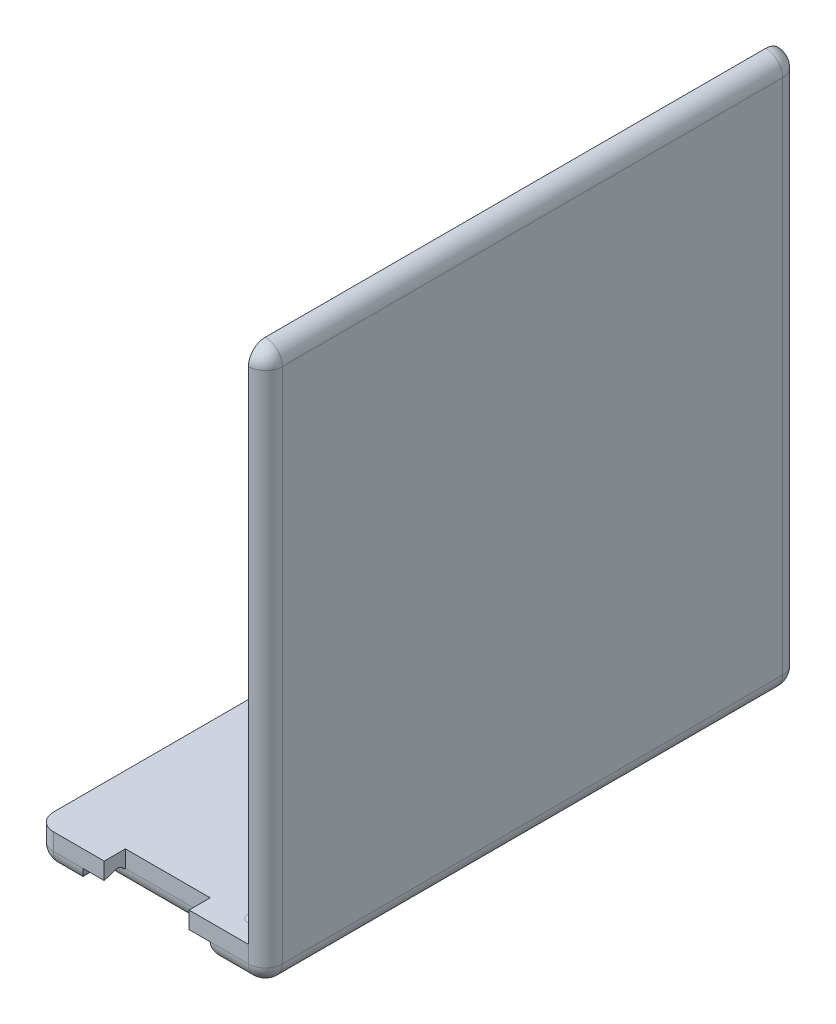
from build123d import *

# Parameters (mm, degrees)
SKETCH1_W               = 25
SKETCH1_H               = 63
BOSS_EXTRUDE1_DEPTH     = 4
SKETCH3_W               = 63
SKETCH3_H               = 4
BOSS_EXTRUDE2_DEPTH     = 2
SKETCH4_W               = 2
SKETCH4_H               = 63
BOSS_EXTRUDE3_DEPTH     = 61
SKETCH6_W               = 10
SKETCH6_H               = 2.5
CUT_EXTRUDE1_DEPTH      = 94.909530933
SKETCH6_3_W             = 10
SKETCH6_3_H             = 2.5
CUT_EXTRUDE2_DEPTH      = 80
SKETCH8_W               = 15
SKETCH8_H               = 2
CUT_EXTRUDE3_DEPTH      = 2.5
CUT_EXTRUDE5_DEPTH      = 15
SKETCH11_W              = 15
SKETCH11_H              = 2
CUT_EXTRUDE6_DEPTH      = 3
CUT_EXTRUDE7_DEPTH      = 15
FILLET6_R               = 2
FILLET7_R               = 2
BOSS_EXTRUDE4_DEPTH     = 53
FILLET8_R               = 0.4
FILLET9_R               = 2
CUT_EXTRUDE8_DEPTH      = 94.909530933
CUT_EXTRUDE8_DEPTH_BACK = 2
SKETCH15_W              = 11
SKETCH15_H              = 8


# Some blends are built 0.0001 mm under size
with BuildPart() as part:
    # Sketch1 → Boss-Extrude1 (new body)
    with BuildSketch(Plane(origin=(0, 0, 0), x_dir=(1, 0, 0), z_dir=(0, 1, 0))):
        with Locations((-12.5, -31.5)):
            Rectangle(SKETCH1_W, SKETCH1_H)
    extrude(amount=BOSS_EXTRUDE1_DEPTH)

    # Sketch3 → Boss-Extrude2 (add)
    with BuildSketch(Plane(origin=(0, 0, 0), x_dir=(0, 0, -1), z_dir=(1, 0, 0))):
        with Locations((-31.5, 2)):
            Rectangle(SKETCH3_W, SKETCH3_H)
    extrude(amount=BOSS_EXTRUDE2_DEPTH)

    # Sketch4 → Boss-Extrude3 (add)
    with BuildSketch(Plane(origin=(0, 4, 0), x_dir=(1, 0, 0), z_dir=(0, 1, 0))):
        with Locations((1, -31.5)):
            Rectangle(SKETCH4_W, SKETCH4_H)
    extrude(amount=BOSS_EXTRUDE3_DEPTH)

    # Sketch6 → Cut-Extrude1 (cut, through all)
    with BuildSketch(Plane.XZ):
        with Locations((-12, 1.25)):
            Rectangle(SKETCH6_W, SKETCH6_H)
    extrude(amount=-CUT_EXTRUDE1_DEPTH, mode=Mode.SUBTRACT)

    # Sketch6<3> → Cut-Extrude2 (cut)
    with BuildSketch(Plane.XZ):
        with Locations((-12, 61.75)):
            Rectangle(SKETCH6_3_W, SKETCH6_3_H)
    extrude(amount=-CUT_EXTRUDE2_DEPTH, mode=Mode.SUBTRACT)

    # Sketch8 → Cut-Extrude3 (cut)
    with BuildSketch(Plane.XY.offset(63)):
        with Locations((-12, 1)):
            Rectangle(SKETCH8_W, SKETCH8_H)
    extrude(amount=-CUT_EXTRUDE3_DEPTH, mode=Mode.SUBTRACT)

    # Sketch9 → Cut-Extrude5 (cut)
    with BuildSketch(Plane.ZY.offset(4.5)):
        with BuildLine():
            ThreePointArc((61.5, 2.5), (61, 2.366025404), (60.633974596, 2))
            Line((60.633974596, 2), (63, 2))
            Line((63, 2), (61.5, 2.5))
        make_face()
    extrude(amount=CUT_EXTRUDE5_DEPTH, mode=Mode.SUBTRACT)

    # Sketch11 → Cut-Extrude6 (cut)
    with BuildSketch(Plane(origin=(0, 0, 0), x_dir=(-1, 0, 0), z_dir=(0, 0, -1))):
        with Locations((12, 1)):
            Rectangle(SKETCH11_W, SKETCH11_H)
    extrude(amount=-CUT_EXTRUDE6_DEPTH, mode=Mode.SUBTRACT)

    # Sketch12 → Cut-Extrude7 (cut)
    with BuildSketch(Plane.ZY.offset(4.5)):
        with BuildLine():
            ThreePointArc((2.766025404, 2), (2.4, 2.366025404), (1.9, 2.5))
            Line((1.9, 2.5), (0, 2))
            Line((0, 2), (2.766025404, 2))
        make_face()
    extrude(amount=CUT_EXTRUDE7_DEPTH, mode=Mode.SUBTRACT)

    # Fillet6
    fillet6_edges = [part.edges().sort_by_distance(p)[0] for p in [
        (-19.5, 0, 1.5),
        (-22.25, 0, 0),
        (-25, 0, 31.5),
        (-22.25, 0, 63),
        (-19.5, 0, 61.75),
        (-12, 0, 60.5),
        (-4.5, 0, 61.75),
        (-1.25, 0, 63),
        (2, 0, 31.5),
        (-1.25, 0, 0),
        (-4.5, 0, 1.5),
        (-12, 0, 3),
    ]]
    fillet(fillet6_edges, radius=FILLET6_R - 0.0001)  # a hair under: the kernel refuses the full size

    # Fillet7
    # the kernel refuses this fillet: 2 mm, written as the material it takes off along each edge
    with BuildSketch(Plane(origin=(-23, 0, 61), x_dir=(0, 0, 1), z_dir=(1, 0, 0))) as fillet7_piece_1:
        with BuildLine():
            CenterArc((0.0001, -1.9999), 1.9999, 0, 90)
            Line((2, -1.9999), (2, 0))
            Line((2, 0), (0.0001, 0))
        make_face()
    revolve(axis=Axis((-23, 0, 61), (0, -1, 0)), revolution_arc=90, mode=Mode.SUBTRACT)
    with BuildSketch(Plane(origin=(-23, 0, 2), x_dir=(-1, 0, 0), z_dir=(0, 0, 1))) as fillet7_piece_2:
        with BuildLine():
            CenterArc((0.0001, -1.9999), 1.9999, 0, 90)
            Line((2, -1.9999), (2, 0))
            Line((2, 0), (0.0001, 0))
        make_face()
    revolve(axis=Axis((-23, 0, 2), (0, -1, 0)), revolution_arc=90, mode=Mode.SUBTRACT)
    with BuildSketch(Plane(origin=(-25, 0, 63), x_dir=(0, 0, -1), z_dir=(0, 1, 0)), Plane(origin=(-25, 0, 0), x_dir=(1, 0, 0), z_dir=(0, 1, 0))) as fillet7_piece_3:
        with BuildLine():
            CenterArc((FILLET7_R, -FILLET7_R), FILLET7_R, 90, 90)
            Line((0, -FILLET7_R), (0, 0))
            Line((0, 0), (FILLET7_R, 0))
        make_face()
    extrude(amount=9, mode=Mode.SUBTRACT)

    # Sketch13 → Boss-Extrude4 (add)
    with BuildSketch(Plane(origin=(0, 4, 0), x_dir=(1, 0, 0), z_dir=(0, 1, 0))):
        Polygon((0, -4.25), (-1.5, -4.25), (-1.5, -2.6), (-2.7, -2.6), (-2.7, -5.6), (0, -5.6), align=None)
        Polygon((-1.5, -60.4), (-2.7, -60.4), (-2.7, -57.4), (0, -57.4), (0, -58.75), (-1.5, -58.75), align=None)
    extrude(amount=BOSS_EXTRUDE4_DEPTH)

    # Fillet8
    fillet8_edges = [part.edges().sort_by_distance(p)[0] for p in [
        (0, 30.5, 5.6),
        (-1.5, 4, 3.425),
        (-2.1, 4, 2.6),
        (-1.5, 30.5, 2.6),
        (-2.7, 4, 4.1),
        (-2.7, 30.5, 2.6),
        (-1.35, 4, 5.6),
        (-2.7, 30.5, 5.6),
        (0, 57, 4.925),
        (-2.1, 57, 2.6),
        (-2.7, 57, 4.1),
        (-1.35, 57, 5.6),
        (-1.5, 4, 59.575),
        (-1.5, 30.5, 60.4),
        (-1.35, 4, 57.4),
        (0, 30.5, 57.4),
        (-2.7, 4, 58.9),
        (-2.7, 30.5, 57.4),
        (-2.1, 4, 60.4),
        (-2.7, 30.5, 60.4),
        (0, 57, 58.075),
        (-1.35, 57, 57.4),
        (-2.7, 57, 58.9),
        (-2.1, 57, 60.4),
    ]]
    fillet(fillet8_edges, radius=FILLET8_R)

    # Fillet9
    # the kernel refuses this fillet: 2 mm, written as the material it takes off along each edge
    with BuildSketch(Plane(origin=(0, 0, 61), x_dir=(1, 0, 0), z_dir=(0, 0, -1))) as fillet9_piece_1:
        with BuildLine():
            CenterArc((0.0001, -1.9999), 1.9999, 0, 90)
            Line((2, -1.9999), (2, 0))
            Line((2, 0), (0.0001, 0))
        make_face()
    revolve(axis=Axis((0, 0, 61), (0, -1, 0)), revolution_arc=90, mode=Mode.SUBTRACT)
    with BuildSketch(Plane(origin=(0, 0, 2), x_dir=(0, 0, -1), z_dir=(-1, 0, 0))) as fillet9_piece_2:
        with BuildLine():
            CenterArc((0.0001, -1.9999), 1.9999, 0, 90)
            Line((2, -1.9999), (2, 0))
            Line((2, 0), (0.0001, 0))
        make_face()
    revolve(axis=Axis((0, 0, 2), (0, -1, 0)), revolution_arc=90, mode=Mode.SUBTRACT)
    with BuildSketch(Plane(origin=(0, 63, 61), x_dir=(0, 0, 1), z_dir=(1, 0, 0))) as fillet9_piece_3_section:
        Polygon((0, 0), (FILLET9_R, 0), (FILLET9_R, -FILLET9_R), (0, -FILLET9_R), align=None)
    fillet9_piece_3 = extrude(amount=FILLET9_R, mode=Mode.PRIVATE)
    fillet9_piece_3 = fillet9_piece_3 - Plane(origin=(0, 63, 61), x_dir=(0, -0.7071067811865475, -0.7071067811865475), z_dir=(1, 0, 0)) * Sphere(FILLET9_R, mode=Mode.PRIVATE)
    add(fillet9_piece_3, mode=Mode.SUBTRACT)
    with BuildSketch(Plane(origin=(0, 63, 2), x_dir=(0, 0, -1), z_dir=(0, 1, 0))) as fillet9_piece_4_section:
        Polygon((0, 0), (FILLET9_R, 0), (FILLET9_R, -FILLET9_R), (0, -FILLET9_R), align=None)
    fillet9_piece_4 = extrude(amount=FILLET9_R, mode=Mode.PRIVATE)
    fillet9_piece_4 = fillet9_piece_4 - Plane(origin=(0, 63, 2), x_dir=(-0.7071067811865474, 0, 0.7071067811865476), z_dir=(0, 1, 0)) * Sphere(FILLET9_R, mode=Mode.PRIVATE)
    add(fillet9_piece_4, mode=Mode.SUBTRACT)
    with BuildSketch(Plane(origin=(2, 63, 63), x_dir=(-1, 0, 0), z_dir=(0, -1, 0)), Plane(origin=(2, 63, 0), x_dir=(0, 0, 1), z_dir=(0, -1, 0))) as fillet9_piece_5:
        with BuildLine():
            CenterArc((FILLET9_R, FILLET9_R), FILLET9_R, 180, 90)
            Line((0, FILLET9_R), (0, 0))
            Line((0, 0), (FILLET9_R, 0))
        make_face()
    extrude(amount=63, mode=Mode.SUBTRACT)
    with BuildSketch(Plane(origin=(2, 65, 2), x_dir=(-1, 0, 0), z_dir=(0, 0, 1))) as fillet9_piece_6:
        with BuildLine():
            CenterArc((FILLET9_R, FILLET9_R), FILLET9_R, 180, 90)
            Line((0, FILLET9_R), (0, 0))
            Line((0, 0), (FILLET9_R, 0))
        make_face()
    extrude(amount=59, mode=Mode.SUBTRACT)
    with BuildSketch(Plane(origin=(-5, 65, 0), x_dir=(0, 0, 1), z_dir=(1, 0, 0))) as fillet9_piece_7:
        with BuildLine():
            CenterArc((FILLET9_R, FILLET9_R), FILLET9_R, 180, 90)
            Line((0, FILLET9_R), (0, 0))
            Line((0, 0), (FILLET9_R, 0))
        make_face()
    extrude(amount=5, mode=Mode.SUBTRACT)
    with BuildSketch(Plane(origin=(0, 65, 63), x_dir=(0, -1, 0), z_dir=(-1, 0, 0))) as fillet9_piece_8:
        with BuildLine():
            CenterArc((FILLET9_R, -FILLET9_R), FILLET9_R, 90, 90)
            Line((0, -FILLET9_R), (0, 0))
            Line((0, 0), (FILLET9_R, 0))
        make_face()
    extrude(amount=5, mode=Mode.SUBTRACT)

    # Sketch15 → Cut-Extrude8 (cut, two sides: drawn at the far end of the back side and taken through both)
    with BuildSketch(Plane(origin=(0, 0, 0), x_dir=(-1, 0, 0), z_dir=(0, -1, 0)).offset(-CUT_EXTRUDE8_DEPTH_BACK)):
        with Locations((11.5, -42.5)):
            Rectangle(SKETCH15_W, SKETCH15_H)
        Polygon((22, -31.625), (17, -38.5), (6, -38.5), (1, -31.625), align=None)
        with BuildLine():
            ThreePointArc((15.742640687, -27.382359313), (11.5, -25.625), (7.257359313, -27.382359313))
            ThreePointArc((7.257359313, -27.382359313), (7.257359313, -28.796572875), (8.671572875, -28.796572875))
            ThreePointArc((8.671572875, -28.796572875), (11.5, -27.625), (14.328427125, -28.796572875))
            ThreePointArc((14.328427125, -28.796572875), (15.742640687, -28.796572875), (15.742640687, -27.382359313))
        make_face()
        with BuildLine():
            ThreePointArc((18.864708263, -24.14094547), (11.415609445, -21.125339137), (4.01594547, -24.260291737))
            ThreePointArc((4.01594547, -24.260291737), (4.027311781, -25.674459622), (5.441479666, -25.663093311))
            ThreePointArc((5.441479666, -25.663093311), (11.431683837, -23.12527454), (17.461906689, -25.566479666))
            ThreePointArc((17.461906689, -25.566479666), (18.876074574, -25.555113355), (18.864708263, -24.14094547))
        make_face()
        with BuildLine():
            ThreePointArc((22.106601718, -21.018398282), (11.5, -16.625), (0.893398282, -21.018398282))
            ThreePointArc((0.893398282, -21.018398282), (0.893398282, -22.432611845), (2.307611845, -22.432611845))
            ThreePointArc((2.307611845, -22.432611845), (11.5, -18.625), (20.692388155, -22.432611845))
            ThreePointArc((20.692388155, -22.432611845), (22.106601718, -22.432611845), (22.106601718, -21.018398282))
        make_face()
    extrude(amount=CUT_EXTRUDE8_DEPTH + CUT_EXTRUDE8_DEPTH_BACK, mode=Mode.SUBTRACT)


solid = part.part
